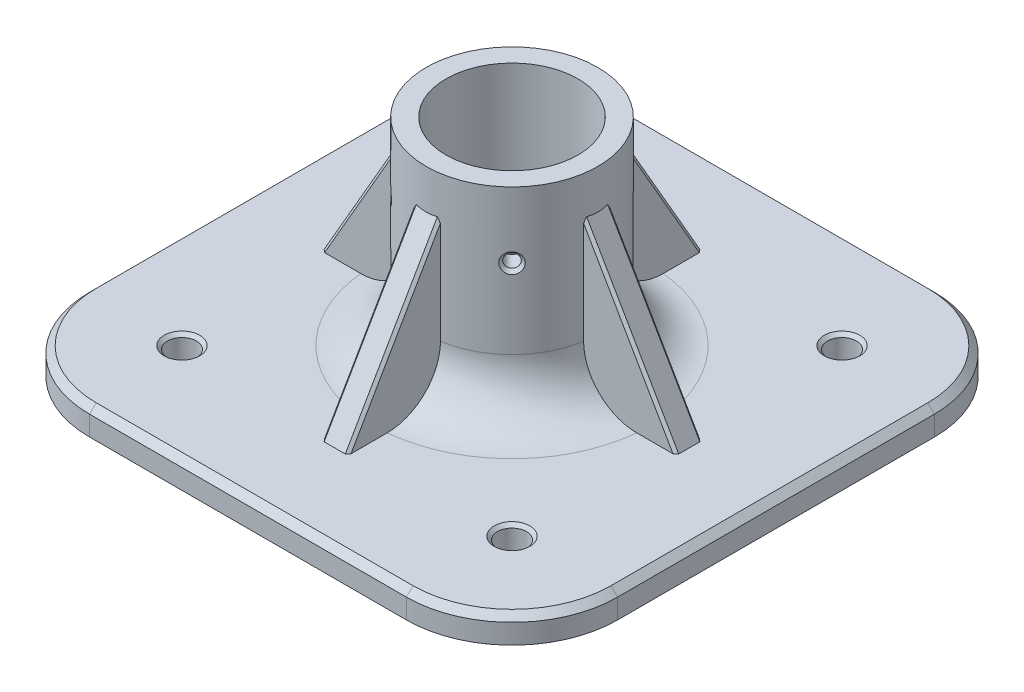
from build123d import *

# Parameters (mm, degrees)
SKETCH1_W                  = 200
SKETCH1_H                  = 200
BOSS_EXTRUDE1_DEPTH        = 10
SKETCH2_R                  = 32.5
SKETCH2_R_2                = 25
BOSS_EXTRUDE2_DEPTH        = 75
RIB1_REACH                 = 167
SKETCH3_WALL_W             = 401.282032302
SKETCH3_WALL_H             = 10
CIRPATTERN1_COUNT          = 4
MOUNTING_HOLES_D           = 11
MOUNTING_HOLES_CSINK_D     = 13.5
MOUNTING_HOLES_CSINK_ANGLE = 90
FILLET1_R                  = 20
FILLET2_R                  = 40
CHAMFER1_SIZE              = 2.5
CHAMFER2_SIZE              = 1


# Read off the part's stored shape, not the designer's step: M6x1.0 Tapped Hole1, M6x1.0 Tapped Hole2
with BuildPart() as part:
    # Sketch1 → Boss-Extrude1 (new body)
    with BuildSketch(Plane(origin=(0, 0, 0), x_dir=(1, 0, 0), z_dir=(0, 1, 0))):
        Rectangle(SKETCH1_W, SKETCH1_H)
    extrude(amount=BOSS_EXTRUDE1_DEPTH)

    # Sketch2 → Boss-Extrude2 (add)
    with BuildSketch(Plane(origin=(0, 10, 0), x_dir=(1, 0, 0), z_dir=(0, 1, 0))):
        with Locations(Location((0, 0, 0), (0, 0, 90))):
            Circle(SKETCH2_R)
        with Locations(Location((0, 0, 0), (0, 0, 270))):
            Circle(SKETCH2_R_2, mode=Mode.SUBTRACT)
    extrude(amount=BOSS_EXTRUDE2_DEPTH)

    # Sketch3 wall → Rib1 (add, up to next)
    with BuildSketch(Plane(origin=(49.820508076, 40, 0), x_dir=(0.499999999996, -0.866025403787, 0), z_dir=(0.866025403787, 0.499999999996, 0)), mode=Mode.PRIVATE) as rib1_sk1:
        Rectangle(SKETCH3_WALL_W, SKETCH3_WALL_H)
    rib1_tool1 = extrude(rib1_sk1.sketch, amount=-RIB1_REACH, mode=Mode.PRIVATE) - part.part
    rib1 = rib1_tool1.solids().sort_by_distance((49.820508076, 40, 0))[0]
    add(rib1)

    # CirPattern1: Rib1 ×4 about axis
    cirpattern1_axis = Axis((0, 0, 0), (0, 1, 0))
    for i in range(1, CIRPATTERN1_COUNT):
        add(rib1.rotate(cirpattern1_axis, i * 360 / CIRPATTERN1_COUNT))

    # M6x1.0 Tapped Hole1 outline → M6x1.0 Tapped Hole1 (revolve, cut)
    with BuildSketch(Plane(origin=(0, 60, 0), x_dir=(0.707106781186546, 0, 0.707106781186549), z_dir=(0, 1, 0))):
        Polygon((0, -32.500112934), (3.750112934, -32.500112934), (2.5, -31.25), (2.5, -24.874618187), (0, -24.874618187), align=None)
    revolve(axis=Axis((0, 60, 0), (0.707106781186549, 0, -0.707106781186546)), mode=Mode.SUBTRACT)

    # M6x1.0 Tapped Hole2 outline → M6x1.0 Tapped Hole2 (revolve, cut)
    with BuildSketch(Plane(origin=(0, 60, 0), x_dir=(0.707106781186546, 0, -0.707106781186549), z_dir=(0, -1, 0))):
        Polygon((3.750104401, 32.500104401), (0, 32.500104401), (0, 24.874618187), (2.5, 24.874618187), (2.5, 31.25), align=None)
    revolve(axis=Axis((0, 60, 0), (0.707106781186549, 0, 0.707106781186546)), mode=Mode.SUBTRACT)

    # Mounting Holes (through all)
    with Locations(Plane(origin=(0, 10, 0), x_dir=(1, 0, 0), z_dir=(0, 1, 0))):
        with Locations((-62.5, 62.5), (62.5, 62.5), (62.5, -62.5), (-62.5, -62.5)):
            CounterSinkHole(MOUNTING_HOLES_D / 2, MOUNTING_HOLES_CSINK_D / 2, counter_sink_angle=MOUNTING_HOLES_CSINK_ANGLE)

    # Fillet1
    fillet1_edges = [part.edges().sort_by_distance(p)[0] for p in [
        (-22.980970389, 10, -22.980970389),
        (22.980970389, 10, -22.980970389),
        (22.980970389, 10, 22.980970389),
        (-22.980970389, 10, 22.980970389),
    ]]
    fillet(fillet1_edges, radius=FILLET1_R)

    # Fillet2
    fillet2_edges = [part.edges().sort_by_distance(p)[0] for p in [
        (100, 5, 100),
        (-100, 5, 100),
        (-100, 5, -100),
        (100, 5, -100),
    ]]
    fillet(fillet2_edges, radius=FILLET2_R)

    # Chamfer1
    chamfer1_edges = [part.edges().sort_by_distance(p)[0] for p in [
        (-100, 10, 0),
        (0, 10, -100),
        (0, 10, 100),
        (100, 10, 0),
        (-88.284271247, 10, 88.284271247),
        (88.284271247, 10, 88.284271247),
        (88.284271247, 10, -88.284271247),
        (-88.284271247, 10, -88.284271247),
    ]]
    chamfer(chamfer1_edges, length=CHAMFER1_SIZE)

    # Chamfer2
    chamfer2_edges = [part.edges().sort_by_distance(p)[0] for p in [
        (-49.627048799, 40.335081297, -5),
        (-49.627048799, 40.335081297, 5),
        (-5, 40.335081297, 49.627048799),
        (5, 40.335081297, 49.627048799),
        (49.627048799, 40.335081297, 5),
        (49.627048799, 40.335081297, -5),
        (-5, 40.335081297, -49.627048799),
        (5, 40.335081297, -49.627048799),
    ]]
    chamfer(chamfer2_edges, length=CHAMFER2_SIZE)


solid = part.part
